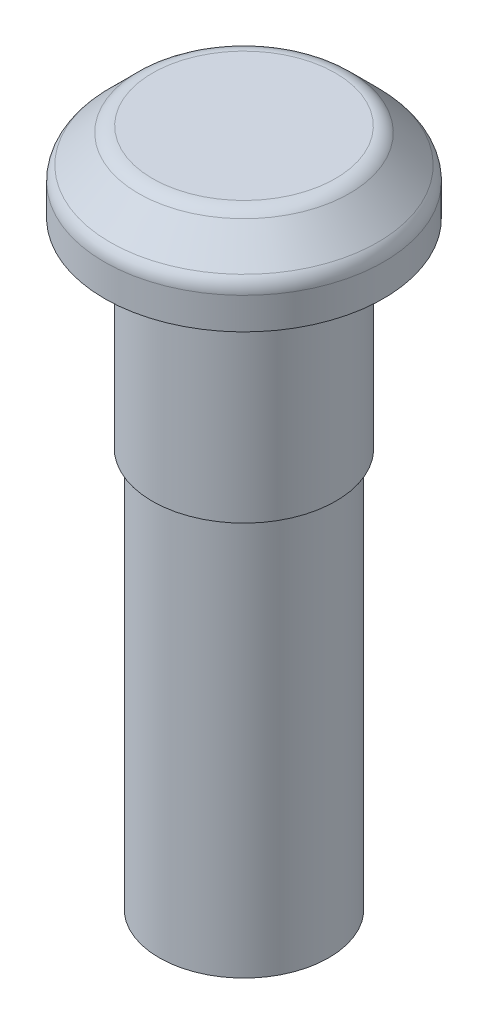
from build123d import *

# Parameters (mm, degrees)
SKETCH1_R           = 2.3
BOSS_EXTRUDE1_DEPTH = 15
SKETCH2_R           = 3.5
BOSS_EXTRUDE2_DEPTH = 2
CHAMFER1_SIZE       = 1
FILLET1_R           = 0.5
SKETCH3_R           = 2.3
SKETCH3_R_2         = 2.125
CUT_EXTRUDE1_DEPTH  = 10


with BuildPart() as part:
    # Sketch1 → Boss-Extrude1 (new body)
    with BuildSketch(Plane(origin=(0, 0, 0), x_dir=(1, 0, 0), z_dir=(0, 1, 0))):
        Circle(SKETCH1_R)
    extrude(amount=BOSS_EXTRUDE1_DEPTH)

    # Sketch2 → Boss-Extrude2 (add)
    with BuildSketch(Plane(origin=(0, 15, 0), x_dir=(1, 0, 0), z_dir=(0, 1, 0))):
        Circle(SKETCH2_R)
    extrude(amount=BOSS_EXTRUDE2_DEPTH)

    # Chamfer1
    chamfer1_edges = [part.edges().sort_by_distance(p)[0] for p in [
        (-3.5, 17, 0),
    ]]
    chamfer(chamfer1_edges, length=CHAMFER1_SIZE)

    # Fillet1
    fillet1_edges = [part.edges().sort_by_distance(p)[0] for p in [
        (-2.5, 17, 0),
        (-3.5, 16, 0),
    ]]
    fillet(fillet1_edges, radius=FILLET1_R)

    # Sketch3 → Cut-Extrude1 (cut)
    with BuildSketch(Plane.XZ):
        Circle(SKETCH3_R)
        Circle(SKETCH3_R_2, mode=Mode.SUBTRACT)
    extrude(amount=-CUT_EXTRUDE1_DEPTH, mode=Mode.SUBTRACT)


solid = part.part
